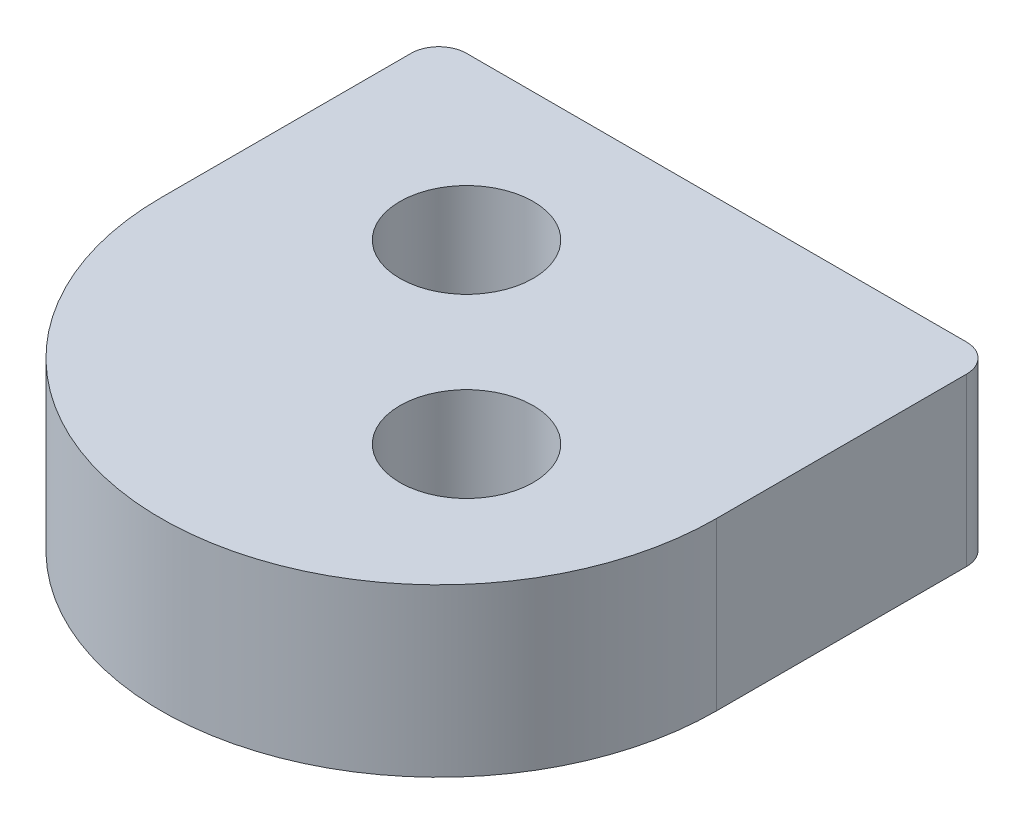
from build123d import *

# Parameters (mm, degrees)
STOCK_U_HANDLE_1_START     = -1.5
STOCK_U_HANDLE_1_OUTLINE_R = 1.2
STOCK_U_HANDLE_1_DEPTH     = 3
FILLET1_R                  = 0.5


# Read off the part's stored shape, not the designer's step: Stock-u-handle-1
with BuildPart() as part:
    # Stock-u-handle-1 outline → Stock-u-handle-1 (new body)
    with BuildSketch(Plane(origin=(0, 0, 0), x_dir=(1, 0, 0), z_dir=(0, 1, 0)).offset(STOCK_U_HANDLE_1_START)):
        with BuildLine():
            Line((5, -32.5), (-5, -32.5))
            Line((-5, -32.5), (-5, -37.5))
            ThreePointArc((-5, -37.5), (0, -42.5), (5, -37.5))
            Line((5, -37.5), (5, -32.5))
        make_face()
        with Locations((1.590990258, -38.590990258)):
            Circle(STOCK_U_HANDLE_1_OUTLINE_R, mode=Mode.SUBTRACT)
        with Locations((-1.590990258, -35.409009742)):
            Circle(STOCK_U_HANDLE_1_OUTLINE_R, mode=Mode.SUBTRACT)
    extrude(amount=STOCK_U_HANDLE_1_DEPTH)

    # Fillet1
    fillet1_edges = [part.edges().sort_by_distance(p)[0] for p in [
        (-5, 0, 32.5),
        (5, 0, 32.5),
    ]]
    fillet(fillet1_edges, radius=FILLET1_R)


solid = part.part
